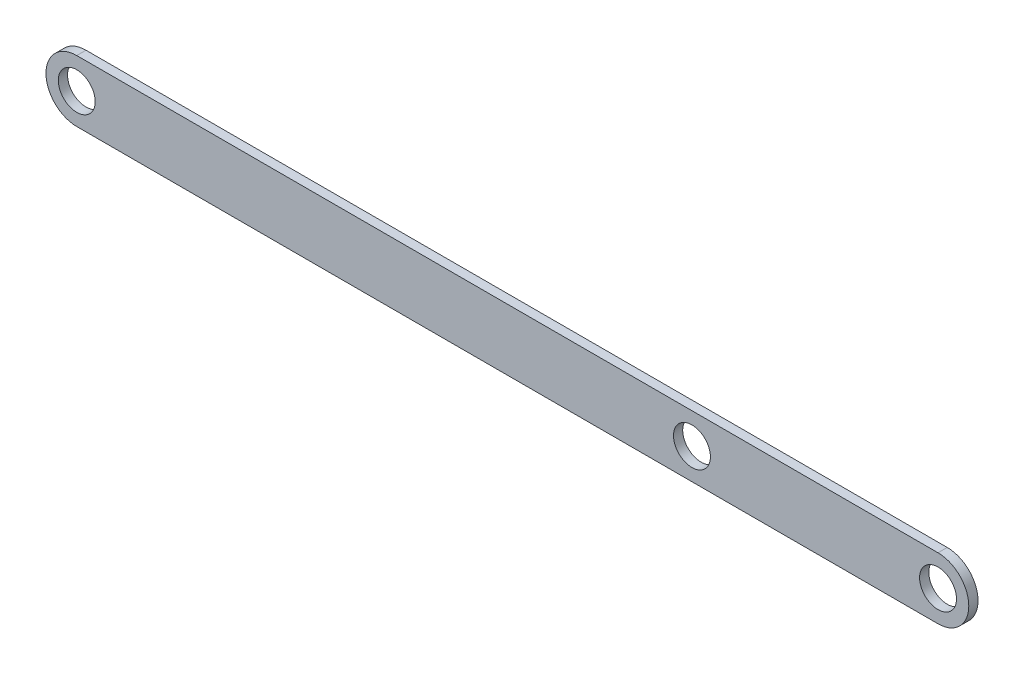
from build123d import *

# Parameters (mm, degrees)
BOSS_EXTRUDE1_DEPTH = 1.5
SKETCH2_R           = 3
CUT_EXTRUDE1_DEPTH  = 146.09393509


with BuildPart() as part:
    # Sketch1 → Boss-Extrude1 (new body)
    with BuildSketch(Plane.XY):
        with BuildLine():
            Line((0, 5), (140, 5))
            ThreePointArc((140, 5), (145, 0), (140, -5))
            Line((140, -5), (0, -5))
            ThreePointArc((0, -5), (-5, 0), (0, 5))
        make_face()
    extrude(amount=BOSS_EXTRUDE1_DEPTH)

    # Sketch2 → Cut-Extrude1 (cut, through all)
    with BuildSketch(Plane.XY.offset(1.5)):
        Circle(SKETCH2_R)
        with Locations((140, 0)):
            Circle(SKETCH2_R)
        with Locations((100, 0)):
            Circle(SKETCH2_R)
    extrude(amount=-CUT_EXTRUDE1_DEPTH, mode=Mode.SUBTRACT)


solid = part.part
